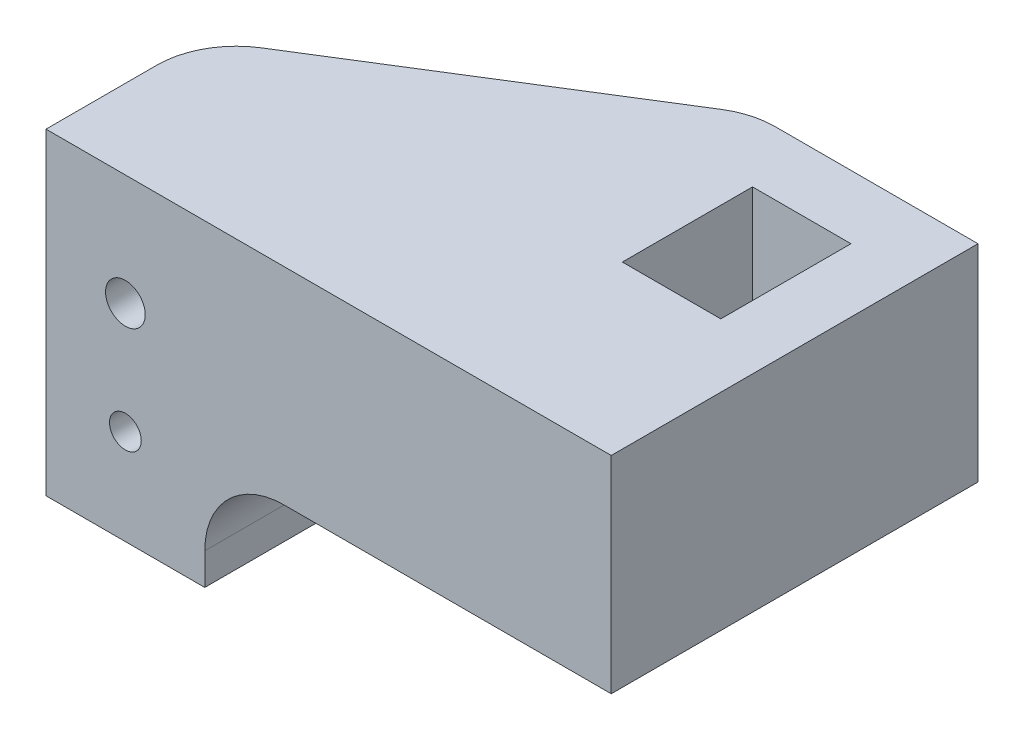
from build123d import *

# Parameters (mm, degrees)
ESQUISSE2_W             = 6.2
ESQUISSE2_H             = 8.2
BOSS_EXTRU_1_DEPTH      = 20
ESQUISSE3_R             = 1.25
ESQUISSE3_R_2           = 1
ESQUISSE3_W             = 25.6
ESQUISSE3_H             = 7
ENL_V_MAT_EXTRU_1_DEPTH = 69.224702271
CONG_1_R                = 5
CONG_2_R                = 5


with BuildPart() as part:
    # Esquisse2 → Boss.-Extru.1 (new body)
    with BuildSketch(Plane(origin=(0, 0, 0), x_dir=(1, 0, 0), z_dir=(0, 1, 0))):
        Polygon((-61, -5), (-51.584269114, -5), (-25.4, -5), (-25.4, 18.1), (-39.6, 18.1), (-61, 4.750279551), align=None)
        with Locations((-32.5, 10)):
            Rectangle(ESQUISSE2_W, ESQUISSE2_H, mode=Mode.SUBTRACT)
    extrude(amount=BOSS_EXTRU_1_DEPTH)

    # Esquisse3 → Enlèv. mat.-Extru.1 (cut, through all)
    with BuildSketch(Plane.XY.offset(5)):
        with Locations((-56, 12.999901199)):
            Circle(ESQUISSE3_R)
        with Locations((-56, 5.999901199)):
            Circle(ESQUISSE3_R_2)
        with Locations((-38.2, 3.5)):
            Rectangle(ESQUISSE3_W, ESQUISSE3_H)
    extrude(amount=-ENL_V_MAT_EXTRU_1_DEPTH, mode=Mode.SUBTRACT)

    # Congé1
    cong_1_edges = [part.edges().sort_by_distance(p)[0] for p in [
        (-51, 7, -2.994233338),
    ]]
    fillet(cong_1_edges, radius=CONG_1_R)

    # Congé2
    cong_2_edges = [part.edges().sort_by_distance(p)[0] for p in [
        (-39.6, 13.5, -18.1),
        (-61, 10, -4.750279551),
    ]]
    fillet(cong_2_edges, radius=CONG_2_R)


solid = part.part
